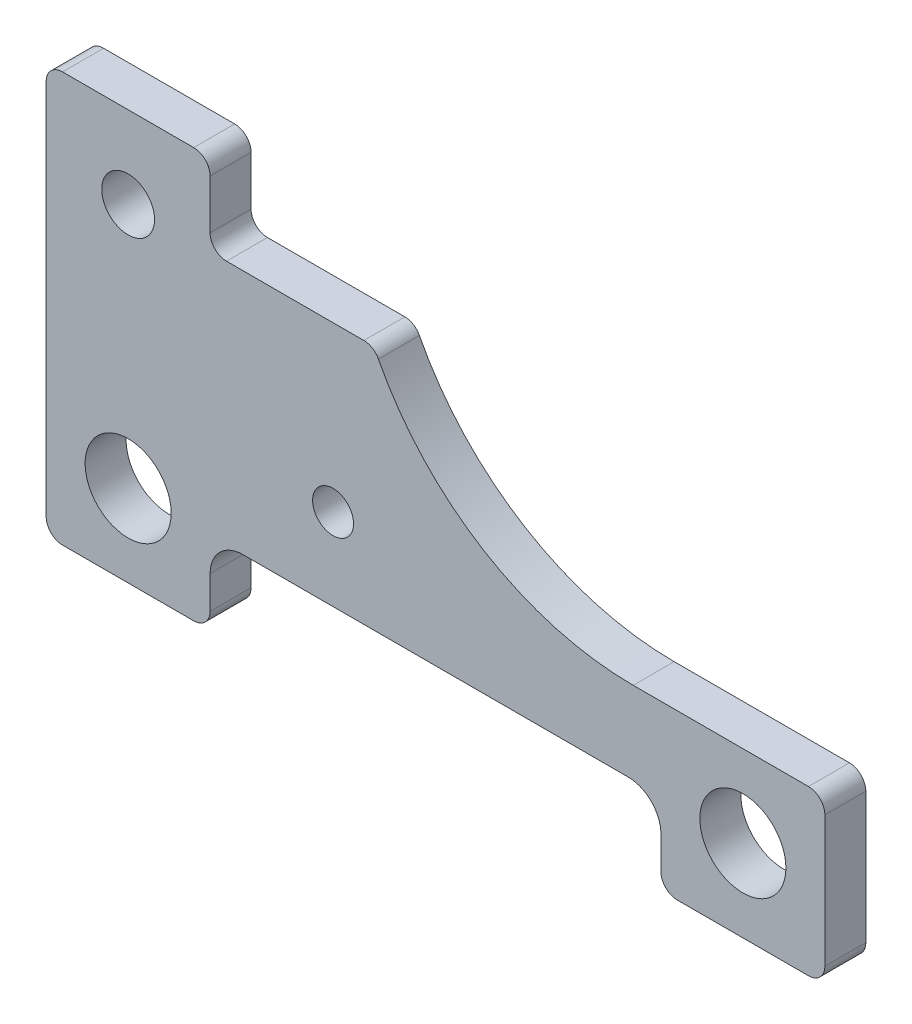
from build123d import *

# Parameters (mm, degrees)
SKETCH1_R           = 5.25
SKETCH1_R_2         = 3.225
SKETCH1_R_3         = 2.5
BOSS_EXTRUDE1_DEPTH = 2.5
FILLET1_R           = 4
FILLET3_R           = 2


with BuildPart() as part:
    # Sketch1 → Boss-Extrude1 (new, symmetric)
    with BuildSketch(Plane.XY):
        with BuildLine():
            Line((-47.5, 0), (-47.5, 50))
            Line((-47.5, 50), (-27.5, 50))
            Line((-27.5, 50), (-27.5, 40))
            Line((-27.5, 40), (-7.5, 40))
            ThreePointArc((-7.5, 40), (5.414502852, 25.418195989), (24.123722991, 19.998004673))
            Line((24.123722991, 19.998004673), (47.5, 19.998004673))
            Line((47.5, 19.998004673), (47.5, -0.001995327))
            Line((47.5, -0.001995327), (27.5, -0.001995327))
            Line((27.5, -0.001995327), (27.5, 10))
            Line((27.5, 10), (-27.5, 10))
            Line((-27.5, 10), (-27.5, 0))
            Line((-27.5, 0), (-47.5, 0))
        make_face()
        with Locations((-37.5, 10)):
            Circle(SKETCH1_R, mode=Mode.SUBTRACT)
        with Locations((-37.5, 40)):
            Circle(SKETCH1_R_2, mode=Mode.SUBTRACT)
        with Locations((-12.5, 20)):
            Circle(SKETCH1_R_3, mode=Mode.SUBTRACT)
        with Locations((37.5, 9.998004673)):
            Circle(SKETCH1_R, mode=Mode.SUBTRACT)
    extrude(amount=BOSS_EXTRUDE1_DEPTH, both=True)

    # Fillet1
    fillet1_edges = [part.edges().sort_by_distance(p)[0] for p in [
        (27.5, 10, 0),
        (-27.5, 10, 0),
    ]]
    fillet(fillet1_edges, radius=FILLET1_R)

    # Fillet3
    fillet3_edges = [part.edges().sort_by_distance(p)[0] for p in [
        (-7.5, 40, 0),
        (27.5, -0.001995327, 0),
        (47.5, -0.001995327, 0),
        (47.5, 19.998004673, 0),
        (-27.5, 40, 0),
        (-27.5, 50, 0),
        (-47.5, 50, 0),
        (-27.5, 0, 0),
        (-47.5, 0, 0),
    ]]
    fillet(fillet3_edges, radius=FILLET3_R)


solid = part.part
